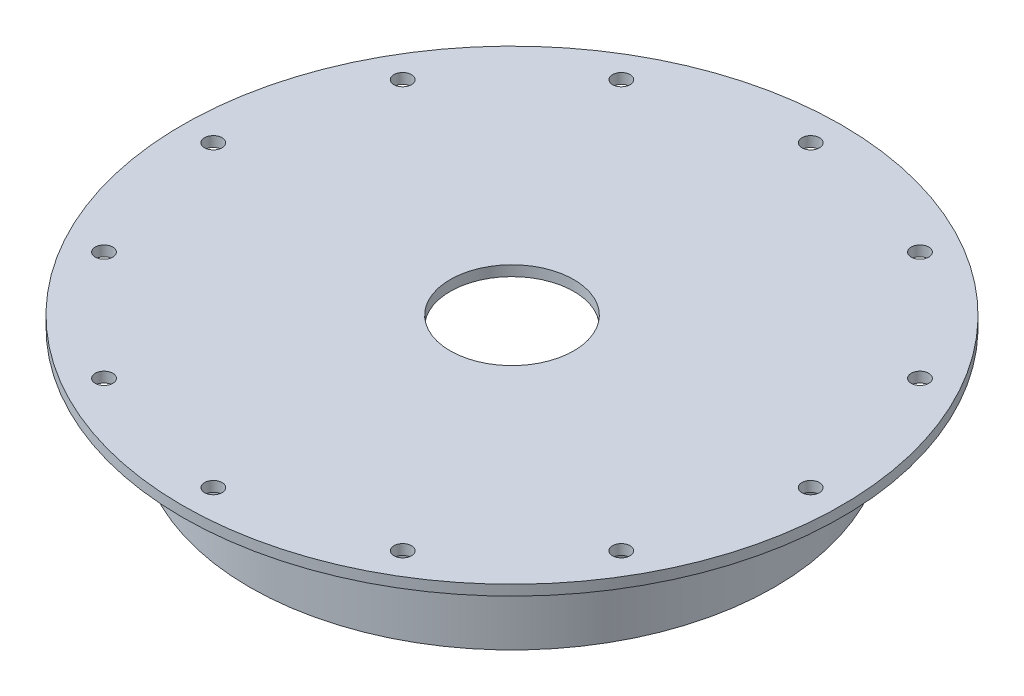
from build123d import *

# Parameters (mm, degrees)
F_36_0_1065_DIAMETER_HOLE1_D = 2.7051
CIRPATTERN1_COUNT            = 12


with BuildPart() as part:
    # Sketch1 → Revolve1 (revolve)
    with BuildSketch(Plane.XY):
        Polygon((-50.8, 0), (-40.436128957, 0), (-40.436128957, -14.516721549), (-35.330893159, -14.516721549), (-35.330893159, 0), (-9.525, 0), (-9.525, 1.5875), (-50.8, 1.5875), align=None)
    revolve(axis=Axis((0, 55, 0), (0, -1, 0)))

    # #36 (0.1065) Diameter Hole1 (through all)
    with Locations(Plane(origin=(0, 1.5875, 0), x_dir=(1, 0, 0), z_dir=(0, 1, 0))):
        with Locations((-46.0375, 0)):
            f_36_0_1065_diameter_hole1 = Hole(F_36_0_1065_DIAMETER_HOLE1_D / 2)

    # CirPattern1: #36 (0.1065) Diameter Hole1 ×12 about axis
    cirpattern1_axis = Axis((0, 55, 0), (0, -1, 0))
    for i in range(1, CIRPATTERN1_COUNT):
        add(f_36_0_1065_diameter_hole1.rotate(cirpattern1_axis, i * 360 / CIRPATTERN1_COUNT), mode=Mode.SUBTRACT)


solid = part.part
